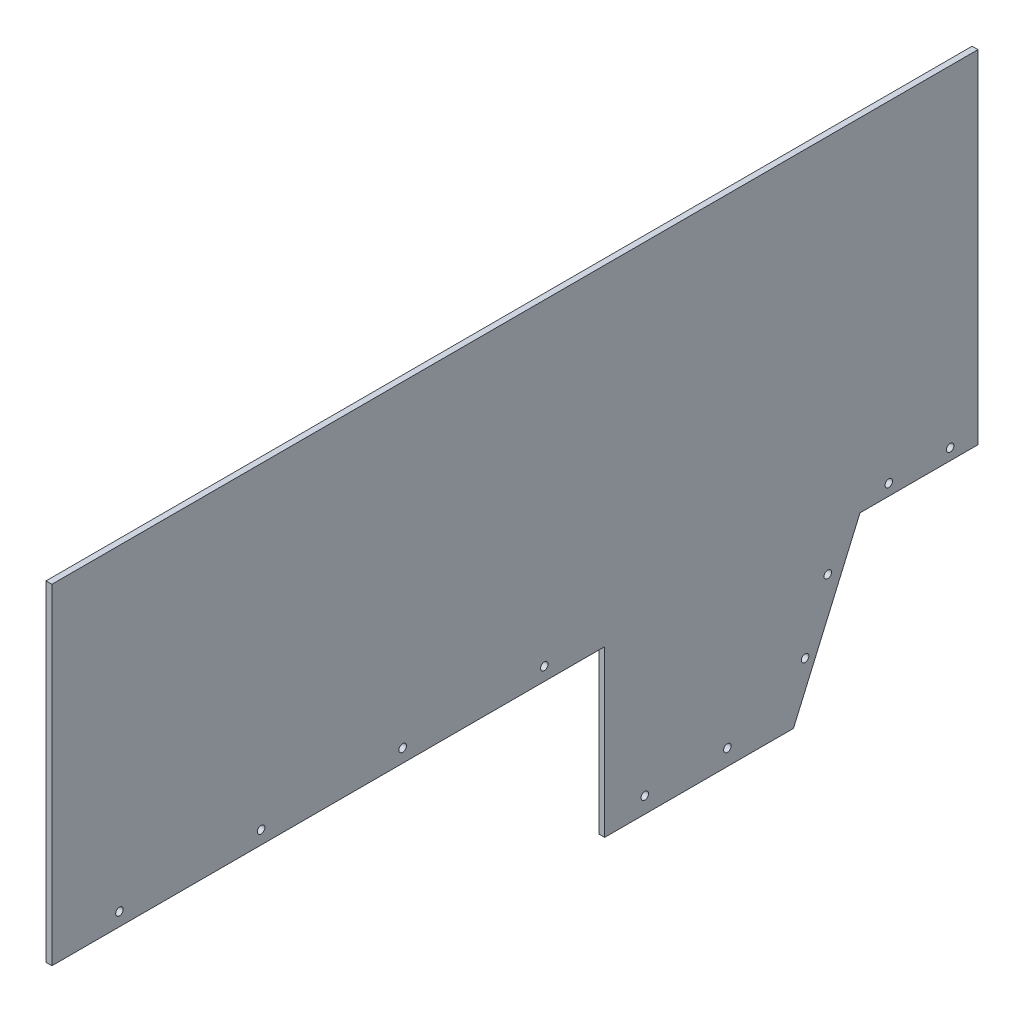
from build123d import *

# Parameters (mm, degrees)
SKETCH1_W           = 498.348
SKETCH1_H           = 177.8
BOSS_EXTRUDE1_DEPTH = 1.5875
BOSS_EXTRUDE2_DEPTH = 3.175
SKETCH3_R           = 2.025
CUT_EXTRUDE1_DEPTH  = 307.121875894
LPATTERN1_COUNT     = 4
LPATTERN1_PITCH     = 76.2
SKETCH4_R           = 2.025
CUT_EXTRUDE2_DEPTH  = 307.121875894
LPATTERN2_COUNT     = 2
LPATTERN2_PITCH     = 44.45
CUT_EXTRUDE3_DEPTH  = 307.121875894
CUT_EXTRUDE5_DEPTH  = 307.121875894
CUT_EXTRUDE6_DEPTH  = 307.121875894
LPATTERN4_COUNT     = 2
LPATTERN4_PITCH     = 33.02


with BuildPart() as part:
    # Sketch1 → Boss-Extrude1 (new, symmetric)
    with BuildSketch(Plane(origin=(0, 0, 0), x_dir=(0, 0, -1), z_dir=(1, 0, 0))):
        Rectangle(SKETCH1_W, SKETCH1_H)
    extrude(amount=BOSS_EXTRUDE1_DEPTH, both=True)

    # Sketch2 → Boss-Extrude2 (add)
    with BuildSketch(Plane(origin=(1.5875, 0, 0), x_dir=(0, 0, -1), z_dir=(1, 0, 0))):
        Polygon((249.174, -95.25), (249.174, -88.9), (48.2854, -88.9), (48.2854, -177.8), (149.8854, -177.8), (185.674, -95.25), align=None)
    extrude(amount=-BOSS_EXTRUDE2_DEPTH)

    # Sketch3 → Cut-Extrude1 (cut, through all)
    with BuildSketch(Plane(origin=(1.5875, 0, 0), x_dir=(0, 0, -1), z_dir=(1, 0, 0))):
        with Locations((15.7854, -81.770353604)):
            Circle(SKETCH3_R)
    cut_extrude1 = extrude(amount=-CUT_EXTRUDE1_DEPTH, mode=Mode.SUBTRACT)

    # LPattern1: Cut-Extrude1 ×4
    with Locations(*[(0, 0, i * LPATTERN1_PITCH) for i in range(1, LPATTERN1_COUNT)]):
        add(cut_extrude1, mode=Mode.SUBTRACT)

    # Sketch4 → Cut-Extrude2 (cut, through all)
    with BuildSketch(Plane.ZY.offset(1.5875)):
        with Locations((-69.8754, -169.164)):
            Circle(SKETCH4_R)
    cut_extrude2 = extrude(amount=-CUT_EXTRUDE2_DEPTH, mode=Mode.SUBTRACT)

    # LPattern2: Cut-Extrude2 ×2
    with Locations(*[(0, 0, -i * LPATTERN2_PITCH) for i in range(1, LPATTERN2_COUNT)]):
        add(cut_extrude2, mode=Mode.SUBTRACT)

    # Sketch5 → Cut-Extrude3 (cut, through all)
    with BuildSketch(Plane.ZY.offset(1.5875)):
        with BuildLine():
            ThreePointArc((-157.986768525, -149.006429583), (-155.71754548, -150.183741475), (-154.103857451, -148.200953675))
            ThreePointArc((-154.103857451, -148.200953675), (-156.540169421, -146.218165874), (-157.986768525, -149.006429583))
        make_face()
    extrude(amount=-CUT_EXTRUDE3_DEPTH, mode=Mode.SUBTRACT)

    # Sketch8 → Cut-Extrude5 (cut, through all)
    with BuildSketch(Plane.ZY.offset(1.5875)):
        with BuildLine():
            ThreePointArc((-168.75136389, -117.212757006), (-167.064950082, -116.797831299), (-166.320220483, -115.228904054))
            ThreePointArc((-166.320220483, -115.228904054), (-169.625490884, -113.659976809), (-168.75136389, -117.212757006))
        make_face()
    extrude(amount=-CUT_EXTRUDE5_DEPTH, mode=Mode.SUBTRACT)

    # Sketch9 → Cut-Extrude6 (cut, through all)
    with BuildSketch(Plane.ZY.offset(1.5875)):
        with BuildLine():
            ThreePointArc((-201.170653386, -91.179), (-199.738762154, -90.585891232), (-199.145653386, -89.154))
            ThreePointArc((-199.145653386, -89.154), (-202.602544618, -87.722108768), (-201.170653386, -91.179))
        make_face()
    cut_extrude6 = extrude(amount=-CUT_EXTRUDE6_DEPTH, mode=Mode.SUBTRACT)

    # LPattern4: Cut-Extrude6 ×2
    with Locations(*[(0, 0, -i * LPATTERN4_PITCH) for i in range(1, LPATTERN4_COUNT)]):
        add(cut_extrude6, mode=Mode.SUBTRACT)


solid = part.part
